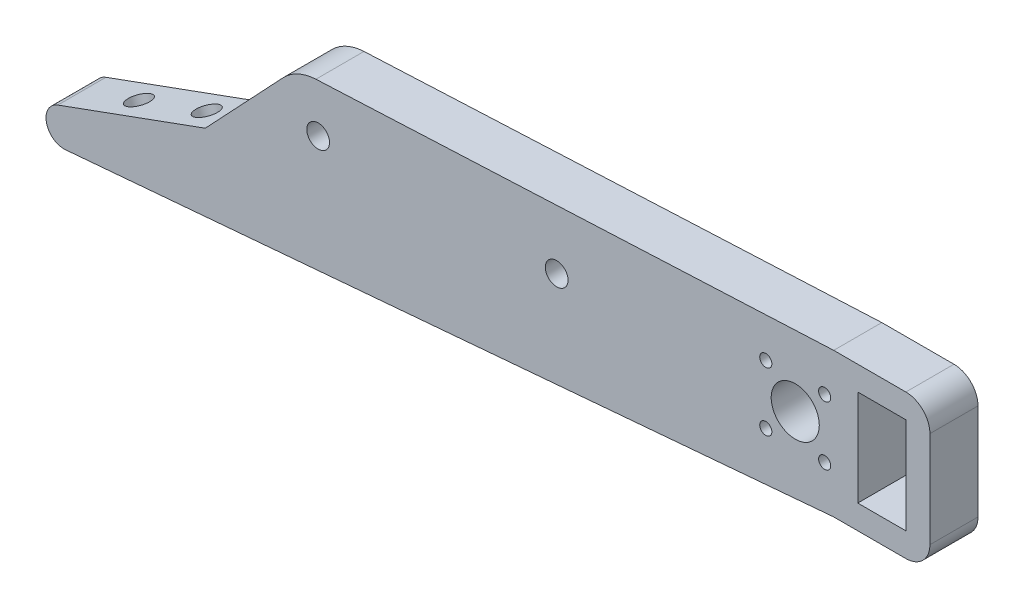
from build123d import *

# Parameters (mm, degrees)
SKETCH1_R           = 1.499997
SKETCH1_R_2         = 0.8
SKETCH1_R_3         = 3.175
SKETCH1_W           = 6.35
SKETCH1_H           = 12.7
BOSS_EXTRUDE1_DEPTH = 3.175
FILLET1_R           = 3.175
SKETCH2_R           = 1.5
CUT_EXTRUDE1_DEPTH  = 6


with BuildPart() as part:
    # Sketch1 → Boss-Extrude1 (new, symmetric)
    with BuildSketch(Plane.XY):
        with BuildLine():
            Line((49.276, 9.525), (36.576, 9.525))
            Line((36.576, 9.525), (-31.791214639, 6.343133951))
            ThreePointArc((-31.791214639, 6.343133951), (-34.148654973, 5.769395254), (-36.118832942, 4.353379789))
            Line((-36.118832942, 4.353379789), (-46.397973184, -6.561989517))
            Line((-46.397973184, -6.561989517), (-65.861496639, -13.646132709))
            ThreePointArc((-65.861496639, -13.646132709), (-67.372222956, -16.397560002), (-64.842812423, -18.25625))
            Line((-64.842812423, -18.25625), (36.576, -9.525))
            Line((36.576, -9.525), (49.276, -9.525))
            Line((49.276, -9.525), (49.276, 9.525))
        make_face()
        with Locations((-31.496, 0)):
            Circle(SKETCH1_R, mode=Mode.SUBTRACT)
        Circle(SKETCH1_R, mode=Mode.SUBTRACT)
        with Locations((27.606912703, -3.889087297)):
            Circle(SKETCH1_R_2, mode=Mode.SUBTRACT)
        with Locations((35.385087297, -3.889087297)):
            Circle(SKETCH1_R_2, mode=Mode.SUBTRACT)
        with Locations((31.496, 0)):
            Circle(SKETCH1_R_3, mode=Mode.SUBTRACT)
        with Locations((42.926, 0)):
            Rectangle(SKETCH1_W, SKETCH1_H, mode=Mode.SUBTRACT)
        with Locations((27.606912703, 3.889087297)):
            Circle(SKETCH1_R_2, mode=Mode.SUBTRACT)
        with Locations((35.385087297, 3.889087297)):
            Circle(SKETCH1_R_2, mode=Mode.SUBTRACT)
    extrude(amount=BOSS_EXTRUDE1_DEPTH, both=True)

    # Fillet1
    fillet1_edges = [part.edges().sort_by_distance(p)[0] for p in [
        (49.276, -9.525, 0),
        (49.276, 9.525, 0),
    ]]
    fillet(fillet1_edges, radius=FILLET1_R)

    # Sketch2 → Cut-Extrude1 (cut)
    with BuildSketch(Plane(origin=(-3.318549049, 9.117638577, 0), x_dir=(0.9396926207859105, 0.34202014332566305, 0), z_dir=(-0.34202014332566305, 0.9396926207859105, 0))):
        with Locations((-49.019165615, 0)):
            Circle(SKETCH2_R)
        with Locations((-58.544165615, 0)):
            Circle(SKETCH2_R)
    extrude(amount=-CUT_EXTRUDE1_DEPTH, mode=Mode.SUBTRACT)


solid = part.part
